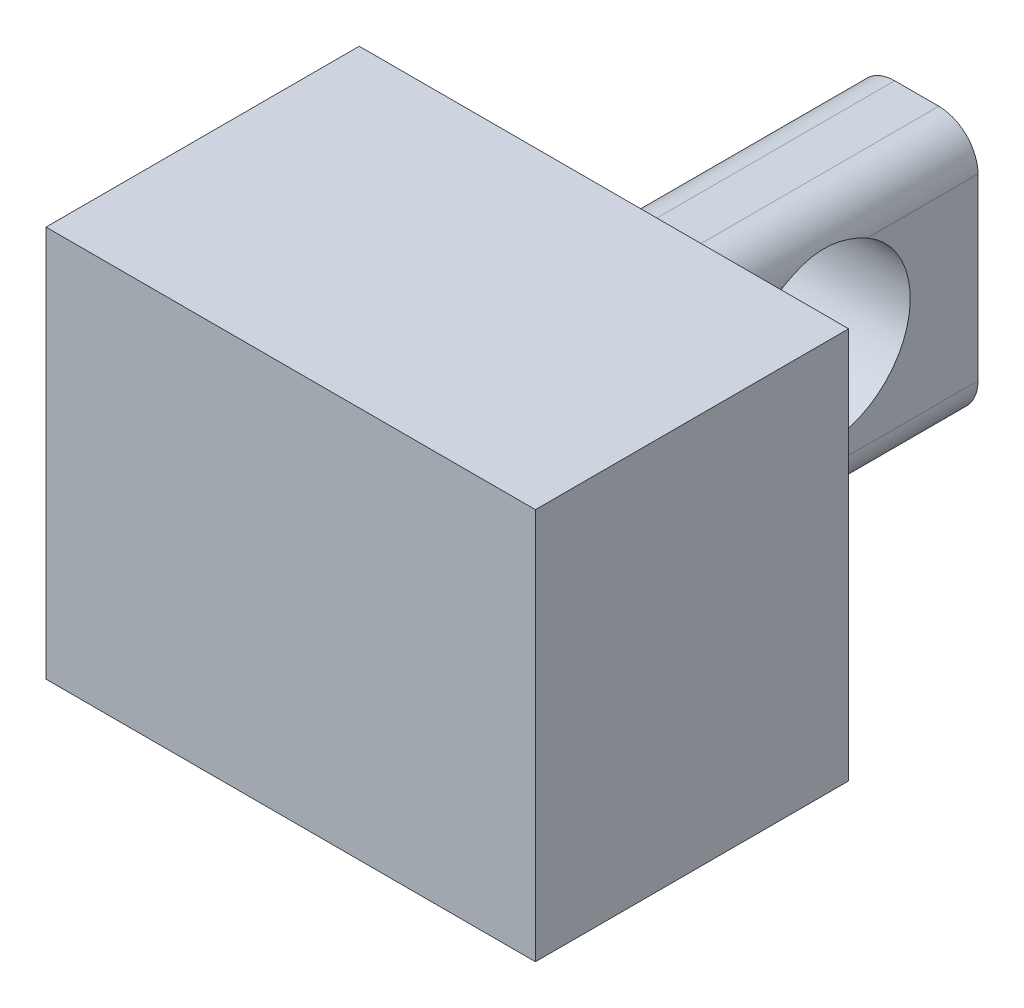
from build123d import *

# Parameters (mm, degrees)
SKETCH1_W               = 1.25
SKETCH1_H               = 1
BOSS_EXTRUDE1_DEPTH     = 0.8
SKETCH2_W               = 0.312740208
SKETCH2_H               = 0.657177059
BOSS_EXTRUDE3_DEPTH     = 0.8
CUT_EXTRUDE1_DEPTH      = 5.644364033
CUT_EXTRUDE1_DEPTH_BACK = 5.644364033
SKETCH3_R               = 0.216417025
FILLET1_R               = 0.1
FILLET2_R               = 0.1
FILLET3_R               = 0.1


with BuildPart() as part:
    # Sketch1 → Boss-Extrude1 (new body)
    with BuildSketch(Plane.XY):
        with Locations((-25.730959564, -4.007907279)):
            Rectangle(SKETCH1_W, SKETCH1_H)
    extrude(amount=BOSS_EXTRUDE1_DEPTH)

    # Sketch2 → Boss-Extrude3 (add)
    with BuildSketch(Plane.XY):
        with Locations((-25.732016119, -4.029038374)):
            Rectangle(SKETCH2_W, SKETCH2_H)
    extrude(amount=-BOSS_EXTRUDE3_DEPTH)

    # Sketch3 → Cut-Extrude1 (cut, two sides: drawn at the far end of the back side and taken through both)
    with BuildSketch(Plane(origin=(-25.575646015, 0, 0), x_dir=(0, 0, -1), z_dir=(1, 0, 0)).offset(-CUT_EXTRUDE1_DEPTH_BACK)):
        with Locations((0.410542062, -3.988999955)):
            Circle(SKETCH3_R)
    extrude(amount=CUT_EXTRUDE1_DEPTH + CUT_EXTRUDE1_DEPTH_BACK, mode=Mode.SUBTRACT)

    # Fillet1
    # the kernel refuses this fillet: 0.1 mm, written as the material it takes off along each edge
    with BuildSketch(Plane(origin=(-25.575646015, -3.700449845, 0), x_dir=(-1, 0, 0), z_dir=(0, 0, -1))) as fillet1_piece_1:
        with BuildLine():
            CenterArc((FILLET1_R, -FILLET1_R), FILLET1_R, 90, 90)
            Line((0, -FILLET1_R), (0, 0))
            Line((0, 0), (FILLET1_R, 0))
        make_face()
    extrude(amount=1.05, mode=Mode.SUBTRACT)

    # Fillet2
    # the kernel refuses this fillet: 0.1 mm, written as the material it takes off along each edge
    with BuildSketch(Plane(origin=(-25.888386223, -3.700449845, 0), x_dir=(1, 0, 0), z_dir=(0, 0, -1))) as fillet2_piece_1:
        with BuildLine():
            CenterArc((FILLET2_R, FILLET2_R), FILLET2_R, 180, 90)
            Line((0, FILLET2_R), (0, 0))
            Line((0, 0), (FILLET2_R, 0))
        make_face()
    extrude(amount=1.05, mode=Mode.SUBTRACT)
    with BuildSketch(Plane(origin=(-25.575646015, -4.357626904, 0), x_dir=(0, 1, 0), z_dir=(0, 0, -1))) as fillet2_piece_2:
        with BuildLine():
            CenterArc((FILLET2_R, -FILLET2_R), FILLET2_R, 90, 90)
            Line((0, -FILLET2_R), (0, 0))
            Line((0, 0), (FILLET2_R, 0))
        make_face()
    extrude(amount=1.05, mode=Mode.SUBTRACT)

    # Fillet3
    fillet3_edges = [part.edges().sort_by_distance(p)[0] for p in [
        (-25.888386223, -4.357626904, -0.4),
    ]]
    fillet(fillet3_edges, radius=FILLET3_R)


solid = part.part
